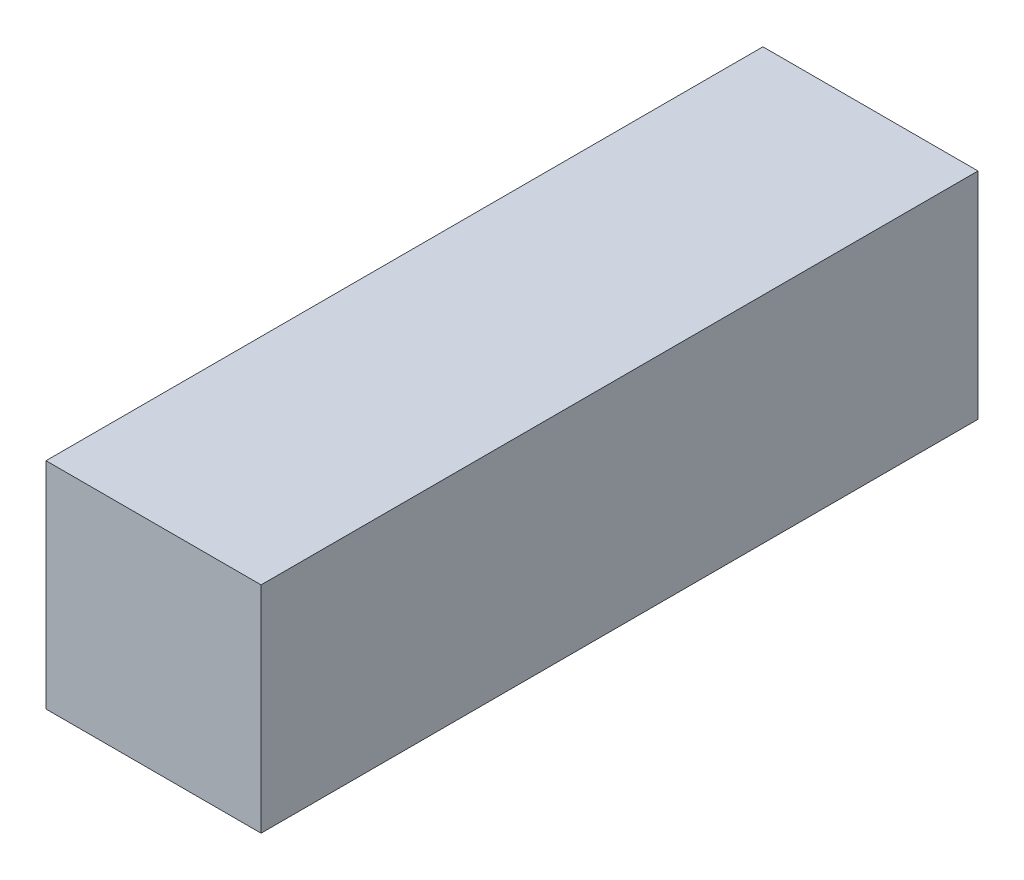
from build123d import *

# Parameters (mm, degrees)
SKETCH1_W           = 38.1
SKETCH1_H           = 38.1
BOSS_EXTRUDE1_DEPTH = 127


with BuildPart() as part:
    # Sketch1 → Boss-Extrude1 (new body)
    with BuildSketch(Plane.XY):
        with Locations((10.31875, 12.79921875)):
            Rectangle(SKETCH1_W, SKETCH1_H)
    extrude(amount=BOSS_EXTRUDE1_DEPTH)


solid = part.part
